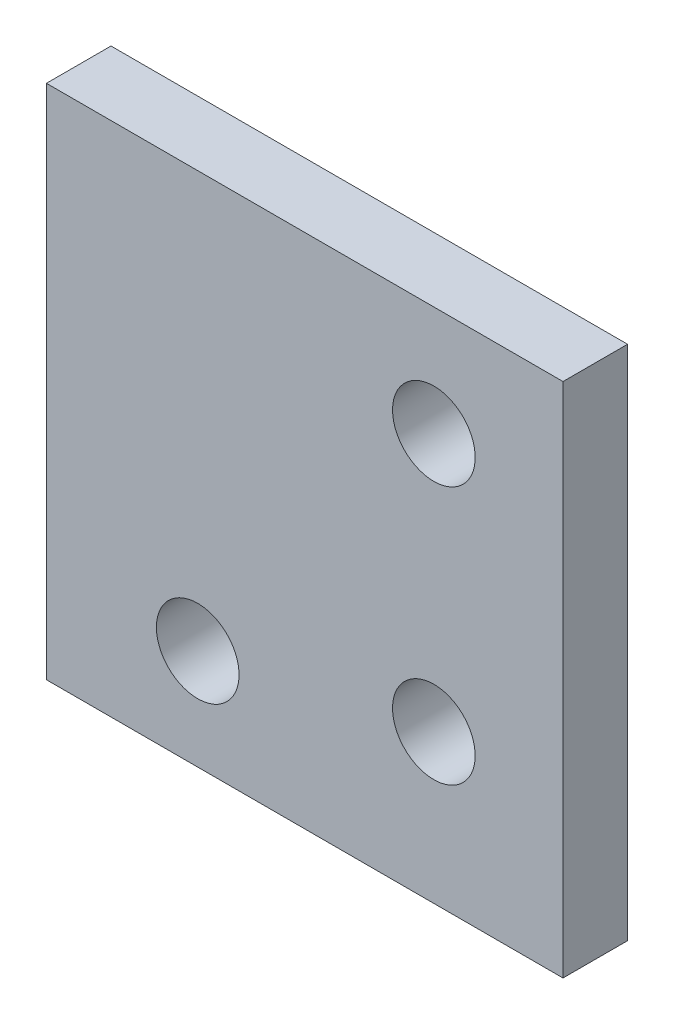
from build123d import *

# Parameters (mm, degrees)
SKETCH1_W               = 25.4
SKETCH1_H               = 25.4
BOSS_EXTRUDE1_DEPTH     = 3.175
CUT_EXTRUDE1_DEPTH      = 19.238986403
CUT_EXTRUDE1_DEPTH_BACK = 19.238986403
SKETCH2_R               = 2.032


with BuildPart() as part:
    # Sketch1 → Boss-Extrude1 (new body)
    with BuildSketch(Plane.XY):
        Rectangle(SKETCH1_W, SKETCH1_H)
    extrude(amount=BOSS_EXTRUDE1_DEPTH)

    # Sketch2 → Cut-Extrude1 (cut, two sides: drawn at the far end of the back side and taken through both)
    with BuildSketch(Plane(origin=(0, 0, 0), x_dir=(-1, 0, 0), z_dir=(0, 0, -1)).offset(-CUT_EXTRUDE1_DEPTH_BACK)):
        with Locations((5.260512242, -7.756353864)):
            Circle(SKETCH2_R)
        with Locations((-6.35, -5.396866107)):
            Circle(SKETCH2_R)
        with Locations((-6.35, 7.303133893)):
            Circle(SKETCH2_R)
    extrude(amount=CUT_EXTRUDE1_DEPTH + CUT_EXTRUDE1_DEPTH_BACK, mode=Mode.SUBTRACT)


solid = part.part
